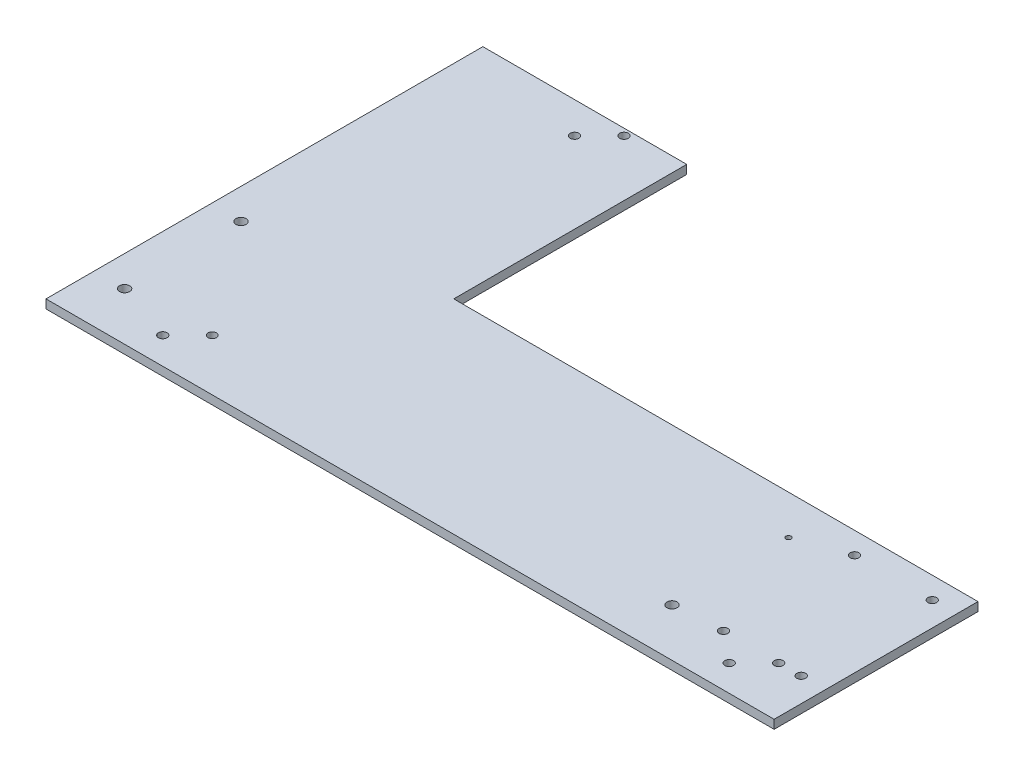
from build123d import *

# Parameters (mm, degrees)
SKETCH1_R           = 1.5
SKETCH1_R_2         = 1.44463942
SKETCH1_R_3         = 1.75
SKETCH1_R_4         = 1.751500306
SKETCH1_R_5         = 0.884734338
BOSS_EXTRUDE1_DEPTH = 3


with BuildPart() as part:
    # Sketch1 → Boss-Extrude1 (new body)
    with BuildSketch(Plane(origin=(0, 0, 0), x_dir=(1, 0, 0), z_dir=(0, 1, 0))):
        Polygon((-125, -35), (125, -35), (125, 35), (-55, 35), (-55, 115), (-125, 115), (-125, 35), align=None)
        with Locations((-94.133157769, -25.756518953)):
            Circle(SKETCH1_R, mode=Mode.SUBTRACT)
        with Locations((-85.647876395, -17.271237578)):
            Circle(SKETCH1_R_2, mode=Mode.SUBTRACT)
        with Locations((100.573185828, -25.992159095)):
            Circle(SKETCH1_R, mode=Mode.SUBTRACT)
        with Locations((109.058467202, -17.506877721)):
            Circle(SKETCH1_R, mode=Mode.SUBTRACT)
        with Locations((-82.760714531, 104.243481047)):
            Circle(SKETCH1_R, mode=Mode.SUBTRACT)
        with Locations((-74.275433157, 112.728762422)):
            Circle(SKETCH1_R, mode=Mode.SUBTRACT)
        with Locations((-114.545142283, 21.486121735)):
            Circle(SKETCH1_R_3, mode=Mode.SUBTRACT)
        with Locations((-114.545142283, -18.469343139)):
            Circle(SKETCH1_R_4, mode=Mode.SUBTRACT)
        with Locations((73.454857717, 21.486121735)):
            Circle(SKETCH1_R_5, mode=Mode.SUBTRACT)
        with Locations((73.454857717, -18.513878265)):
            Circle(SKETCH1_R_3, mode=Mode.SUBTRACT)
        with Locations((90.042184558, 27.571853298)):
            Circle(SKETCH1_R, mode=Mode.SUBTRACT)
        with Locations((116.722059045, 27.571853298)):
            Circle(SKETCH1_R, mode=Mode.SUBTRACT)
        with Locations((116.722059045, -17.428146702)):
            Circle(SKETCH1_R, mode=Mode.SUBTRACT)
        with Locations((90.042184558, -17.428146702)):
            Circle(SKETCH1_R, mode=Mode.SUBTRACT)
    extrude(amount=BOSS_EXTRUDE1_DEPTH)


solid = part.part
